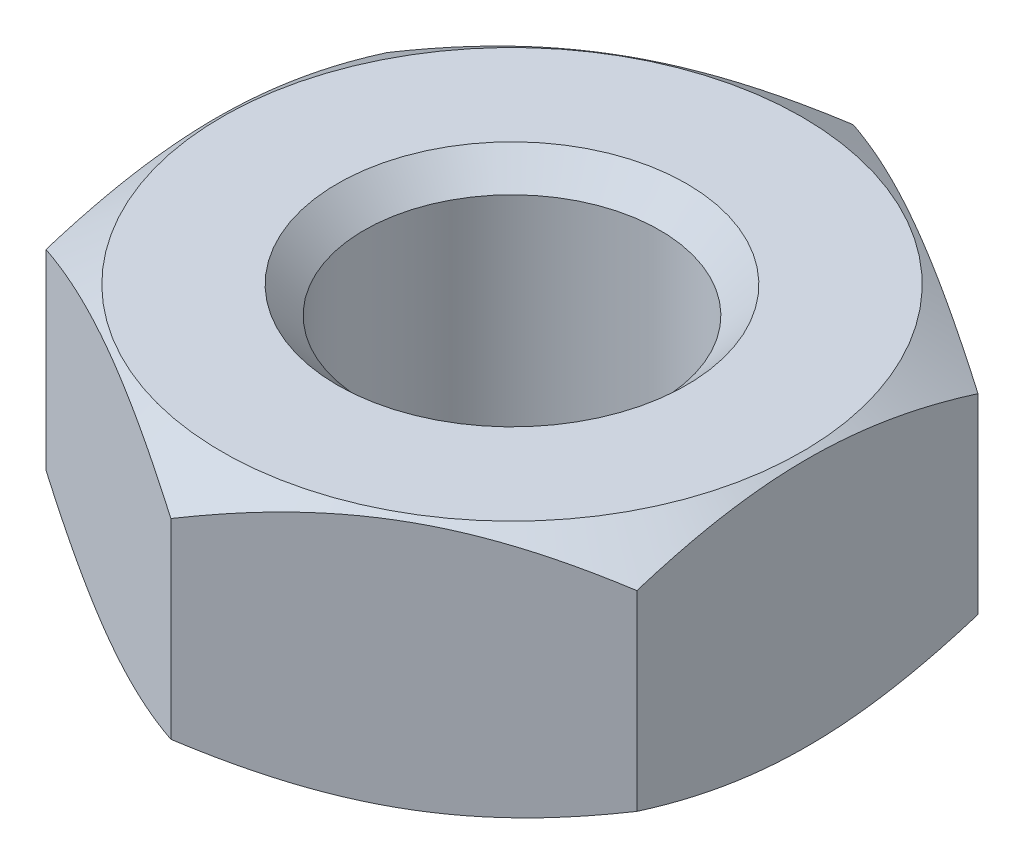
from build123d import *

# Parameters (mm, degrees)
SKETCH1_R           = 1.375
BOSS_EXTRUDE1_DEPTH = 1.19
CHAMFER1_SIZE       = 0.25


with BuildPart() as part:
    # Sketch1 → Boss-Extrude1 (new, symmetric)
    with BuildSketch(Plane(origin=(0, 0, 0), x_dir=(1, 0, 0), z_dir=(0, 1, 0))):
        Polygon((0, 3.175426481), (-2.75, 1.58771324), (-2.75, -1.58771324), (0, -3.175426481), (2.75, -1.58771324), (2.75, 1.58771324), align=None)
        Circle(SKETCH1_R, mode=Mode.SUBTRACT)
    extrude(amount=BOSS_EXTRUDE1_DEPTH, both=True)

    # Sketch2 → Cut-Revolve1 (revolve, cut)
    with BuildSketch(Plane(origin=(0, 0, 0), x_dir=(0, 0, -1), z_dir=(1, 0, 0))):
        Polygon((2.7, 1.19), (3.175426481, 0.89), (3.175426481, 1.19), align=None)
    cut_revolve1 = revolve(axis=Axis((0, 0, 0), (0, 1, 0)), mode=Mode.SUBTRACT)

    # Mirror1: Cut-Revolve1 across plane
    add(cut_revolve1.mirror(Plane.ZX), mode=Mode.SUBTRACT)

    # Chamfer1
    chamfer1_edges = [part.edges().sort_by_distance(p)[0] for p in [
        (-1.375, -1.19, 0),
        (-1.375, 1.19, 0),
    ]]
    chamfer(chamfer1_edges, length=CHAMFER1_SIZE)


solid = part.part
